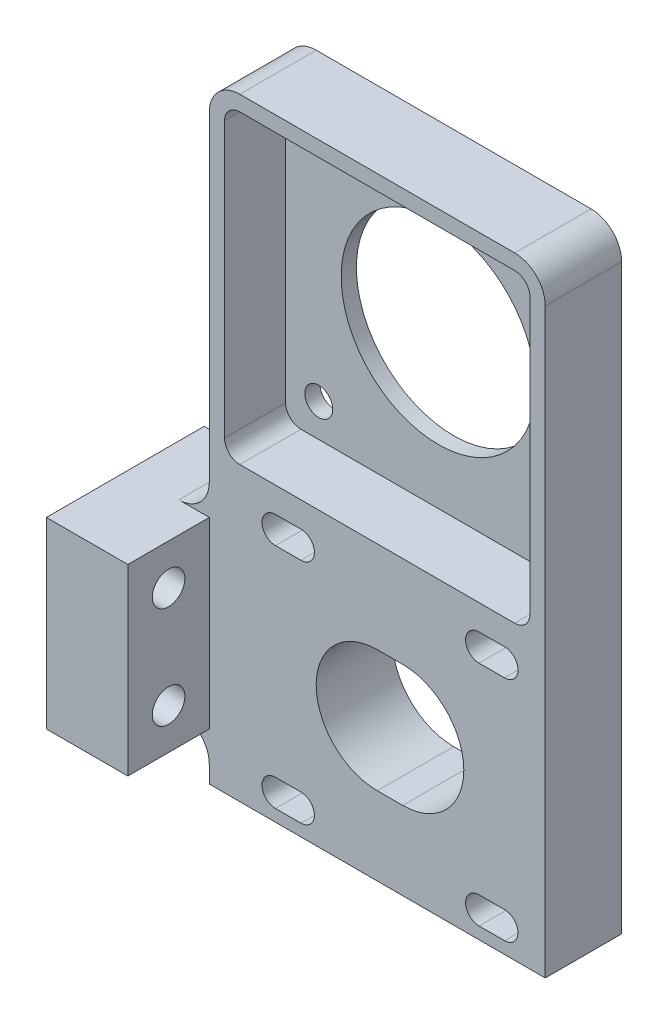
from build123d import *

# Parameters (mm, degrees)
STEPPER_PLATE_SKETCH_R                 = 19.1
PLATE_BOSS_EXTRUDE_DEPTH               = 15
CLEARANCE_HOLE1_D                      = 5.5
SHAFT_CLEARANCE_CUT_EXTRUDE_DEPTH      = 107.183802908
SHAFT_CLEARANCE_CUT_EXTRUDE_DEPTH_BACK = 107.183802908
STEPPER_PLATE_SKETCH_10_W              = 16
STEPPER_PLATE_SKETCH_10_H              = 36
BOSS_EXTRUDE1_DEPTH                    = 16
SKETCH18_W                             = 2.65
SKETCH18_H                             = 15
M5_CLEARANCE_HOLE1_AT_2_COUNT          = 2
M5_CLEARANCE_HOLE1_AT_2_PITCH          = 20
FILLET8_R                              = 6
STEPPER_PLATE_SKETCH_6_W               = 60
STEPPER_PLATE_SKETCH_6_H               = 60
STEPPER_PLATE_SKETCH_6_R               = 19.1
CUT_EXTRUDE1_DEPTH                     = 12
FILLET6_R                              = 3
FILLET7_R                              = 6
M5_CLEARANCE_HOLE3_D                   = 5.3
F_1_0MM_DOWEL_HOLE1_D                  = 6.4
F_1_0MM_DOWEL_HOLE1_DEPTH              = 10
F_1_0MM_DOWEL_HOLE1_TIP                = 1.922753981


with BuildPart() as part:
    # Stepper Plate Sketch → Plate Boss-Extrude (new body)
    with BuildSketch(Plane.XY):
        Polygon((33, 93), (-33, 93), (-33, 18), (-49, 18), (-49, -18), (-33, -18), (-33, -27.360679775), (33, -27.360679775), align=None)
        with BuildLine():
            ThreePointArc((-20, -25.010679775), (-22.65, -22.360679775), (-20, -19.710679775))
            Line((-20, -19.710679775), (-15, -19.710679775))
            ThreePointArc((-15, -19.710679775), (-12.35, -22.360679775), (-15, -25.010679775))
            Line((-15, -25.010679775), (-20, -25.010679775))
        make_face(mode=Mode.SUBTRACT)
        with BuildLine():
            ThreePointArc((-20, 19.710679775), (-22.65, 22.360679775), (-20, 25.010679775))
            Line((-20, 25.010679775), (-15, 25.010679775))
            ThreePointArc((-15, 25.010679775), (-12.35, 22.360679775), (-15, 19.710679775))
            Line((-15, 19.710679775), (-20, 19.710679775))
        make_face(mode=Mode.SUBTRACT)
        with BuildLine():
            ThreePointArc((20, -25.010679775), (17.35, -22.360679775), (20, -19.710679775))
            Line((20, -19.710679775), (25, -19.710679775))
            ThreePointArc((25, -19.710679775), (27.65, -22.360679775), (25, -25.010679775))
            Line((25, -25.010679775), (20, -25.010679775))
        make_face(mode=Mode.SUBTRACT)
        with BuildLine():
            ThreePointArc((20, 19.710679775), (17.35, 22.360679775), (20, 25.010679775))
            Line((20, 25.010679775), (25, 25.010679775))
            ThreePointArc((25, 25.010679775), (27.65, 22.360679775), (25, 19.710679775))
            Line((25, 19.710679775), (20, 19.710679775))
        make_face(mode=Mode.SUBTRACT)
        with Locations((0, 60)):
            Circle(STEPPER_PLATE_SKETCH_R, mode=Mode.SUBTRACT)
    extrude(amount=-PLATE_BOSS_EXTRUDE_DEPTH)

    # Clearance Hole1 (through all)
    with Locations(Plane.XY):
        with Locations((-23.5, 83.5), (-23.5, 36.5), (23.5, 36.5), (23.5, 83.5)):
            Hole(CLEARANCE_HOLE1_D / 2)

    # Stepper Plate Sketch<5> → Shaft Clearance Cut-Extrude (cut, two sides: drawn at the far end of the back side and taken through both)
    with BuildSketch(Plane.XY.offset(-SHAFT_CLEARANCE_CUT_EXTRUDE_DEPTH_BACK)):
        with BuildLine():
            Line((5, 12), (0, 12))
            ThreePointArc((0, 12), (-12, 0), (0, -12))
            Line((0, -12), (5, -12))
            ThreePointArc((5, -12), (17, 0), (5, 12))
        make_face()
    extrude(amount=SHAFT_CLEARANCE_CUT_EXTRUDE_DEPTH + SHAFT_CLEARANCE_CUT_EXTRUDE_DEPTH_BACK, mode=Mode.SUBTRACT)

    # Stepper Plate Sketch<10> → Boss-Extrude1 (add)
    with BuildSketch(Plane.XY):
        with Locations((-41, 0)):
            Rectangle(STEPPER_PLATE_SKETCH_10_W, STEPPER_PLATE_SKETCH_10_H)
    extrude(amount=BOSS_EXTRUDE1_DEPTH)

    # Sketch18 → M5 Clearance Hole1 (revolve, cut)
    with BuildSketch(Plane(origin=(-41, 10, 0), x_dir=(0, -1, 0), z_dir=(1, 0, 0))):
        with Locations((1.325, 7.5)):
            Rectangle(SKETCH18_W, SKETCH18_H)
    m5_clearance_hole1 = revolve(axis=Axis((-41, 10, 6.35), (0, 0, -1)), mode=Mode.SUBTRACT)

    # M5 Clearance Hole1 at 2: M5 Clearance Hole1 ×2
    with Locations(*[(0, -i * M5_CLEARANCE_HOLE1_AT_2_PITCH, 0) for i in range(1, M5_CLEARANCE_HOLE1_AT_2_COUNT)]):
        add(m5_clearance_hole1, mode=Mode.SUBTRACT)

    # Fillet8
    fillet8_edges = [part.edges().sort_by_distance(p)[0] for p in [
        (-33, -18, -7.5),
        (-33, 18, -7.5),
    ]]
    fillet(fillet8_edges, radius=FILLET8_R)

    # Stepper Plate Sketch<6> → Cut-Extrude1 (cut)
    with BuildSketch(Plane.XY):
        with Locations((0, 60)):
            Rectangle(STEPPER_PLATE_SKETCH_6_W, STEPPER_PLATE_SKETCH_6_H)
        with Locations((0, 60)):
            Circle(STEPPER_PLATE_SKETCH_6_R, mode=Mode.SUBTRACT)
    extrude(amount=-CUT_EXTRUDE1_DEPTH, mode=Mode.SUBTRACT)

    # Fillet6
    fillet6_edges = [part.edges().sort_by_distance(p)[0] for p in [
        (30, 90, -6),
        (-30, 90, -6),
        (-30, 30, -6),
        (30, 30, -6),
    ]]
    fillet(fillet6_edges, radius=FILLET6_R)

    # Fillet7
    fillet7_edges = [part.edges().sort_by_distance(p)[0] for p in [
        (33, 93, -7.5),
        (-33, 93, -7.5),
    ]]
    fillet(fillet7_edges, radius=FILLET7_R)

    # M5 Clearance Hole3 (through all)
    with Locations(Plane.ZY.offset(49)):
        with Locations((8, 10), (8, -10)):
            Hole(M5_CLEARANCE_HOLE3_D / 2)

    # Ø1.0mm Dowel Hole1
    with Locations(Plane(origin=(-33, 0, 0), x_dir=(0, 0, -1), z_dir=(1, 0, 0))):
        with Locations((-8, 10), (-8, -10)):
            Hole(F_1_0MM_DOWEL_HOLE1_D / 2, depth=F_1_0MM_DOWEL_HOLE1_DEPTH)
            with Locations((0, 0, -(F_1_0MM_DOWEL_HOLE1_DEPTH + F_1_0MM_DOWEL_HOLE1_TIP / 2))):  # 118° drill point
                Cone(0, F_1_0MM_DOWEL_HOLE1_D / 2, F_1_0MM_DOWEL_HOLE1_TIP, mode=Mode.SUBTRACT)


solid = part.part
